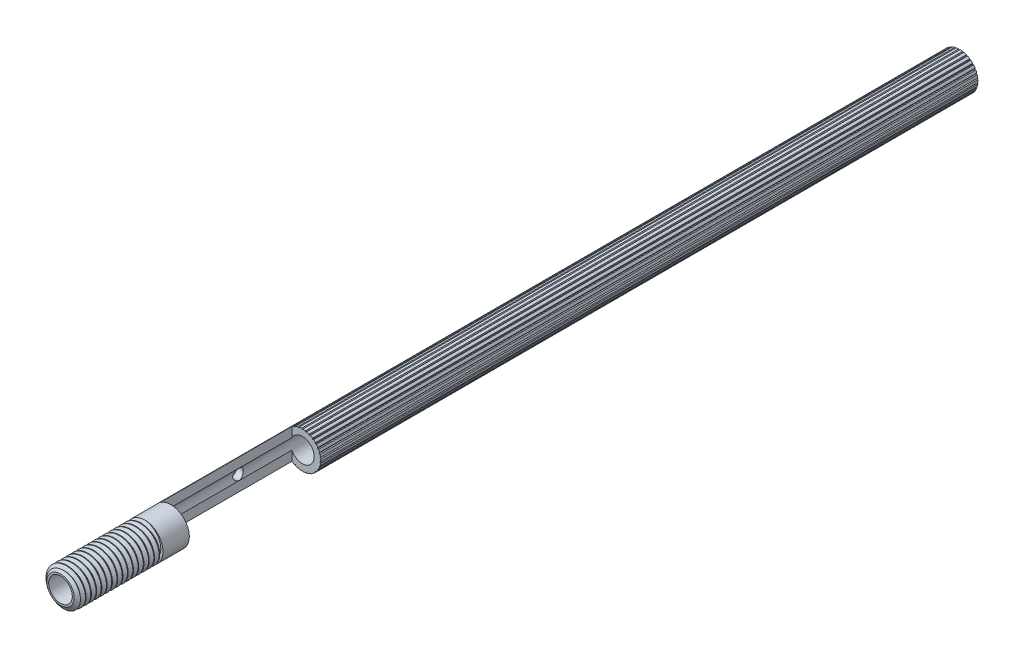
from build123d import *

# Parameters (mm, degrees)
SKETCH1_R               = 3.5
EXTRUDE1_DEPTH          = 16
CUT_SWEEP1_PITCH        = 1
SKETCH6_R               = 2.25
CUT_EXTRUDE1_DEPTH      = 17.748134362
SKETCH7_R               = 3.5
SKETCH7_R_2             = 2.25
BOSS_EXTRUDE1_DEPTH     = 155
CUT_EXTRUDE2_DEPTH      = 6
CUT_EXTRUDE2_DEPTH_BACK = 2
SKETCH8_W               = 25
SKETCH8_H               = 18.770394957
SKETCH9_R               = 1
CUT_EXTRUDE3_DEPTH      = 172.12422389
CUT_EXTRUDE4_START      = -125
CUT_EXTRUDE4_DEPTH      = 125
CIRPATTERN1_COUNT       = 30


with BuildPart() as part:
    # Sketch1 → Extrude1 (new body)
    with BuildSketch(Plane.XY):
        Circle(SKETCH1_R)
    extrude(amount=-EXTRUDE1_DEPTH)

    # Cut-Sweep1: the profile of Sketch3 profile screwed along a right-hand helix of 17 turns, 6 arcs to a turn; built about Z, then put on its axis
    cut_sweep1_z = Axis((0, 0, 0), (0, 0, 1))
    cut_sweep1_corners = [(3.5003, 0, -0.875173205), (2.850480947, 0, -0.5), (2.850480947, 0, -0.375), (3.5003, 0, 0.000173205)]
    with BuildLine(mode=Mode.PRIVATE) as cut_sweep1_profile:
        Line(cut_sweep1_corners[0], cut_sweep1_corners[1])
        Line(cut_sweep1_corners[1], cut_sweep1_corners[2])
        Line(cut_sweep1_corners[2], cut_sweep1_corners[3])
        Line(cut_sweep1_corners[3], cut_sweep1_corners[0])
    cut_sweep1_cap = Face(cut_sweep1_profile.wire())
    cut_sweep1_turn_angles = [0, 30, 60, 90, 120, 150, 180, 210, 240, 270, 300, 330, 360]
    cut_sweep1_turn_weights = [1, 0.8660254037844387, 1, 0.8660254037844387, 1, 0.8660254037844387, 1, 0.8660254037844387, 1, 0.8660254037844387, 1, 0.8660254037844387, 1]
    cut_sweep1_turn_rails = [Edge.make_bspline([Vector(p[0], p[1], 0).rotate(cut_sweep1_z, cut_sweep1_turn_angles[k]) / cut_sweep1_turn_weights[k] + Vector(0, 0, p[2] + CUT_SWEEP1_PITCH * cut_sweep1_turn_angles[k] / 360) for k in range(13)], [0, 0, 0, 1, 1, 2, 2, 3, 3, 4, 4, 5, 5, 6, 6, 6], 2, cut_sweep1_turn_weights) for p in cut_sweep1_corners]
    cut_sweep1_turn_sides = [Face.make_surface_from_curves(cut_sweep1_turn_rails[p[0]], cut_sweep1_turn_rails[p[1]]) for p in [(0, 1), (1, 2), (2, 3), (3, 0)]]
    cut_sweep1 = Plane(origin=(0, 0, 0), x_dir=(0, 1, 0), z_dir=(0, 0, -1)) * Solid(Shell([*[p.moved(Location((0, 0, CUT_SWEEP1_PITCH * i))) for i in range(17) for p in cut_sweep1_turn_sides], cut_sweep1_cap, cut_sweep1_cap.rotate(cut_sweep1_z, 6120).moved(Location((0, 0, CUT_SWEEP1_PITCH * 6120 / 360)))]))
    add(cut_sweep1, mode=Mode.SUBTRACT)

    # Sketch4 → Cut-Revolve1 (revolve, cut)
    with BuildSketch(Plane(origin=(0, 0, 0), x_dir=(0, 0, -1), z_dir=(1, 0, 0))):
        Polygon((0.632650852, 3.5), (0, 2.596480947), (0, 3.5), align=None)
    revolve(axis=Axis((0, 0, 0), (0, 0, -1)), mode=Mode.SUBTRACT)

    # Sketch6 → Cut-Extrude1 (cut, through all)
    with BuildSketch(Plane(origin=(0, 0, -16), x_dir=(-1, 0, 0), z_dir=(0, 0, -1))):
        Circle(SKETCH6_R)
    extrude(amount=-CUT_EXTRUDE1_DEPTH, mode=Mode.SUBTRACT)

    # Sketch7 → Boss-Extrude1 (add)
    with BuildSketch(Plane(origin=(0, 0, -16), x_dir=(-1, 0, 0), z_dir=(0, 0, -1))):
        with Locations(Location((0, 0, 0), (0, 0, 90))):
            Circle(SKETCH7_R)
        Circle(SKETCH7_R_2, mode=Mode.SUBTRACT)
    extrude(amount=BOSS_EXTRUDE1_DEPTH)

    # Sketch8 → Cut-Extrude2 (cut, two sides: drawn at the far end of the back side and taken through both)
    with BuildSketch(Plane(origin=(0, 0, 0), x_dir=(0, 0, -1), z_dir=(1, 0, 0)).offset(-CUT_EXTRUDE2_DEPTH_BACK)):
        with Locations((33.5, -2.315287407)):
            Rectangle(SKETCH8_W, SKETCH8_H)
    extrude(amount=CUT_EXTRUDE2_DEPTH + CUT_EXTRUDE2_DEPTH_BACK, mode=Mode.SUBTRACT)

    # Sketch9 → Cut-Extrude3 (cut, through all)
    with BuildSketch(Plane(origin=(-2, 0, 0), x_dir=(0, 0, -1), z_dir=(1, 0, 0))):
        with Locations((36, 0)):
            Circle(SKETCH9_R)
    extrude(amount=-CUT_EXTRUDE3_DEPTH, mode=Mode.SUBTRACT)

    # Sketch10 → Cut-Extrude4 (cut)
    with BuildSketch(Plane(origin=(0, 0, -171), x_dir=(-1, 0, 0), z_dir=(0, 0, -1)).offset(CUT_EXTRUDE4_START)):
        with BuildLine():
            Line((-2.136536254, 2.772221642), (-1.943028368, 2.719957011))
            Line((-1.943028368, 2.719957011), (-1.929728233, 2.919957011))
            ThreePointArc((-1.929728233, 2.919957011), (-2.03447368, 2.847967143), (-2.136536254, 2.772221642))
        make_face()
    cut_extrude4 = extrude(amount=CUT_EXTRUDE4_DEPTH, mode=Mode.SUBTRACT)

    # CirPattern1: Cut-Extrude4 ×30 about axis
    cirpattern1_axis = Axis((0, 0, 0), (0, 0, 1))
    for i in range(1, CIRPATTERN1_COUNT):
        add(cut_extrude4.rotate(cirpattern1_axis, i * 360 / CIRPATTERN1_COUNT), mode=Mode.SUBTRACT)


solid = part.part
